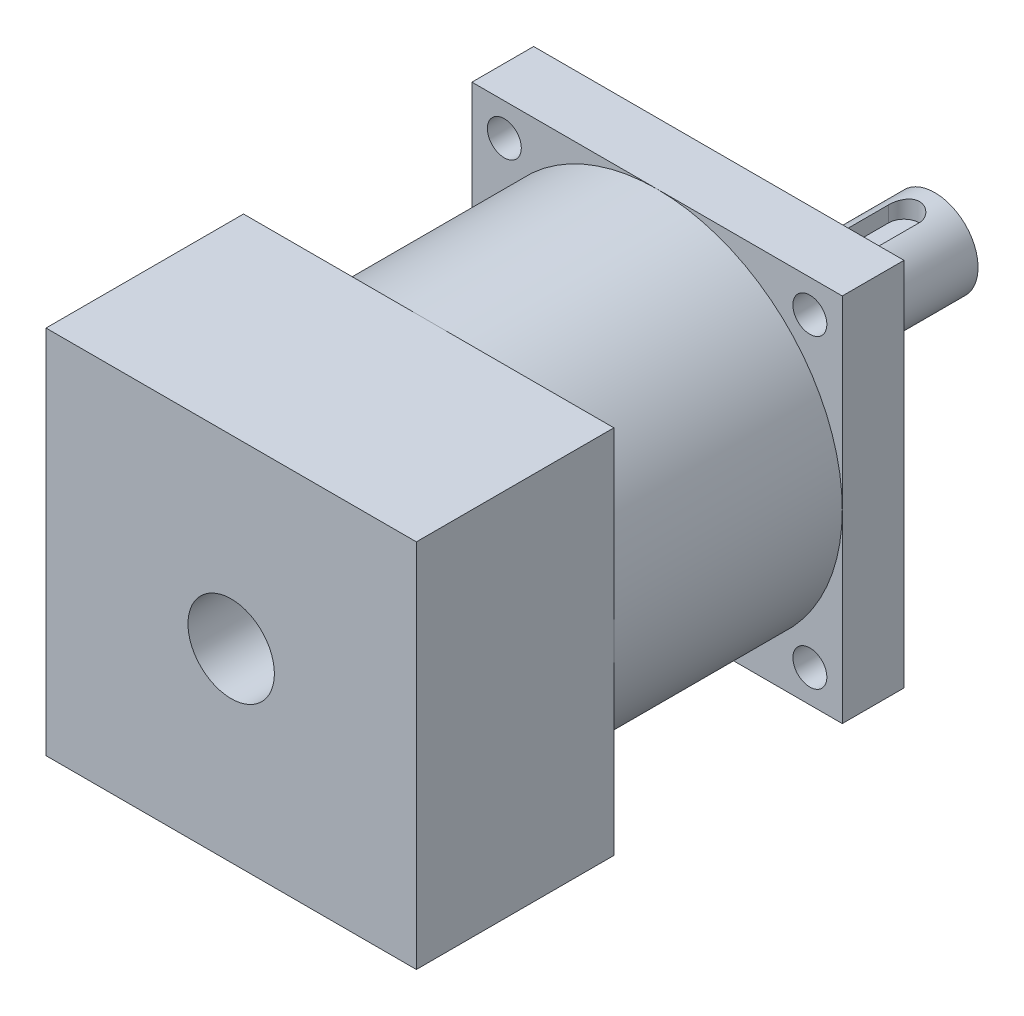
from build123d import *

# Parameters (mm, degrees)
SKETCH_1_W          = 60
SKETCH_1_H          = 60
EXTRUDE_1_DEPTH     = 10
SKETCH_3_R          = 30
EXTRUDE_2_DEPTH     = 37
SKETCH_4_W          = 60
SKETCH_4_H          = 60
EXTRUDE_3_DEPTH     = 32
SKETCH_5_R          = 25
EXTRUDE_4_DEPTH     = 3
SKETCH_6_R          = 8.5
EXTRUDE_5_DEPTH     = 2
SKETCH_7_R          = 7
EXTRUDE_6_DEPTH     = 30
SKETCH_8_R          = 7
CUT_EXTRUDE_1_DEPTH = 30
SKETCH_9_R          = 2.75
CUT_EXTRUDE_2_DEPTH = 30
CUT_EXTRUDE_3_DEPTH = 3


with BuildPart() as part:
    # 草图1 → 拉伸1 (new body)
    with BuildSketch(Plane.XY):
        with Locations((30, -30)):
            Rectangle(SKETCH_1_W, SKETCH_1_H)
    extrude(amount=EXTRUDE_1_DEPTH)

    # 草图3 → 拉伸2 (add)
    with BuildSketch(Plane.XY.offset(10)):
        with Locations((30, -30)):
            Circle(SKETCH_3_R)
    extrude(amount=EXTRUDE_2_DEPTH)

    # 草图4 → 拉伸3 (add)
    with BuildSketch(Plane.XY.offset(47)):
        with Locations((30, -30)):
            Rectangle(SKETCH_4_W, SKETCH_4_H)
    extrude(amount=EXTRUDE_3_DEPTH)

    # 草图5 → 拉伸4 (add)
    with BuildSketch(Plane(origin=(0, 0, 0), x_dir=(-1, 0, 0), z_dir=(0, 0, -1))):
        with Locations((-30, -30)):
            Circle(SKETCH_5_R)
    extrude(amount=EXTRUDE_4_DEPTH)

    # 草图6 → 拉伸5 (add)
    with BuildSketch(Plane(origin=(0, 0, -3), x_dir=(-1, 0, 0), z_dir=(0, 0, -1))):
        with Locations((-30, -30)):
            Circle(SKETCH_6_R)
    extrude(amount=EXTRUDE_5_DEPTH)

    # 草图7 → 拉伸6 (add)
    with BuildSketch(Plane(origin=(0, 0, -5), x_dir=(-1, 0, 0), z_dir=(0, 0, -1))):
        with Locations((-30, -30)):
            Circle(SKETCH_7_R)
    extrude(amount=EXTRUDE_6_DEPTH)

    # 草图8 → 切除-拉伸1 (cut)
    with BuildSketch(Plane.XY.offset(79)):
        with Locations((30, -30)):
            Circle(SKETCH_8_R)
    extrude(amount=-CUT_EXTRUDE_1_DEPTH, mode=Mode.SUBTRACT)

    # 草图9 → 切除-拉伸2 (cut)
    with BuildSketch(Plane(origin=(0, 0, 0), x_dir=(-1, 0, 0), z_dir=(0, 0, -1))):
        with Locations((-5.251262658, -5.251262658)):
            Circle(SKETCH_9_R)
        with Locations((-5.251262658, -54.748737342)):
            Circle(SKETCH_9_R)
        with Locations((-54.748737342, -54.748737342)):
            Circle(SKETCH_9_R)
        with Locations((-54.748737342, -5.251262658)):
            Circle(SKETCH_9_R)
    extrude(amount=-CUT_EXTRUDE_2_DEPTH, mode=Mode.SUBTRACT)

    # 草图10 → 切除-拉伸3 (cut)
    with BuildSketch(Plane(origin=(0, -23, 0), x_dir=(-1, 0, 0), z_dir=(0, 1, 0))):
        with BuildLine():
            Line((-32.5, -10), (-32.5, -30))
            ThreePointArc((-32.5, -30), (-30, -32.5), (-27.5, -30))
            Line((-27.5, -30), (-27.5, -10))
            ThreePointArc((-27.5, -10), (-30, -7.5), (-32.5, -10))
        make_face()
    extrude(amount=-CUT_EXTRUDE_3_DEPTH, mode=Mode.SUBTRACT)


solid = part.part
